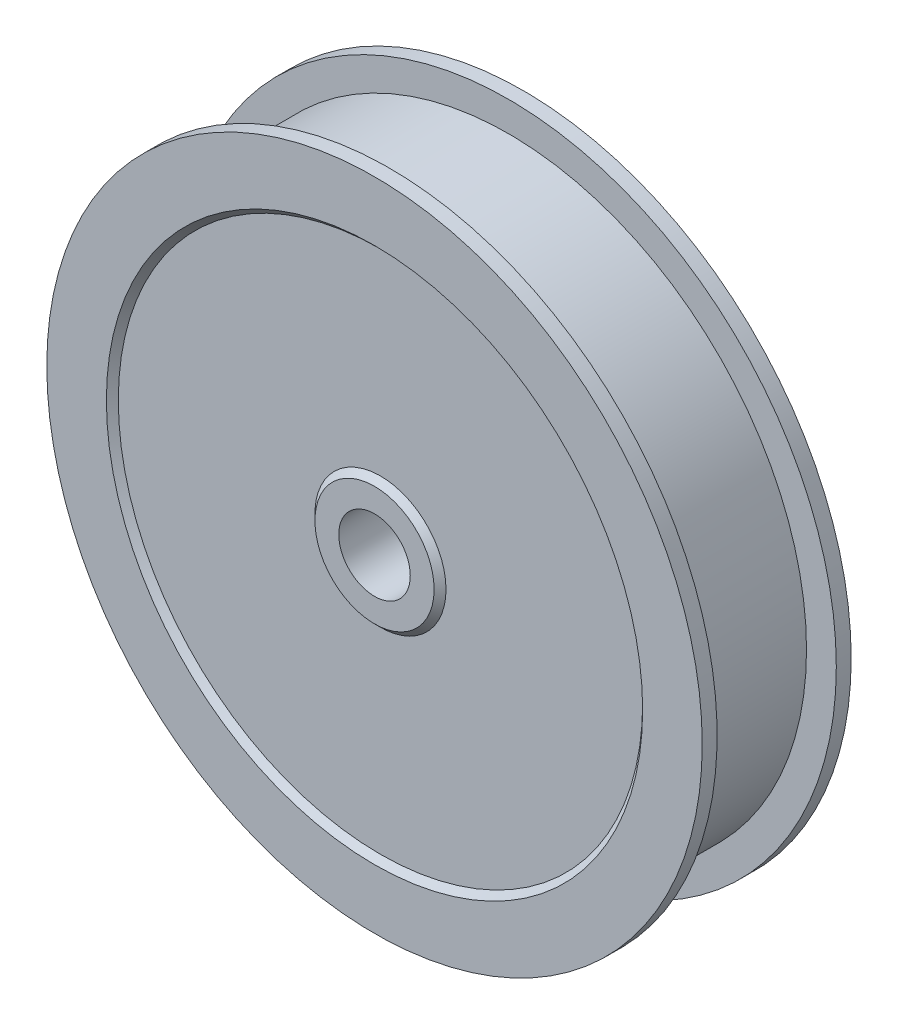
from build123d import *

# Parameters (mm, degrees)
CROQUIS1_R                 = 55
CROQUIS1_R_2               = 6
SALIENTE_EXTRUIR1_DEPTH    = 25
CROQUIS3_W                 = 20
CROQUIS3_H                 = 10
CROQUIS4_R                 = 45
CROQUIS4_R_2               = 10
CORTAR_EXTRUIR1_DEPTH      = 1
CHAFL_N1_SIZE              = 1
CHAFL_N1_OF_SIMETR_A2_SIZE = 1


with BuildPart() as part:
    # Croquis1 → Saliente-Extruir1 (new body)
    with BuildSketch(Plane.XY):
        Circle(CROQUIS1_R)
        Circle(CROQUIS1_R_2, mode=Mode.SUBTRACT)
    extrude(amount=SALIENTE_EXTRUIR1_DEPTH)

    # Croquis3 → Cortar-Revolución1 (revolve, cut)
    with BuildSketch(Plane(origin=(0, 0, 0), x_dir=(0, 0, -1), z_dir=(1, 0, 0)), mode=Mode.PRIVATE) as cortar_revoluci_n1_sk:
        with Locations((-12.5, 55)):
            Rectangle(CROQUIS3_W, CROQUIS3_H)
    revolve(cortar_revoluci_n1_sk.sketch.rotate(Axis((0, 0, 25), (0, 0, -1)), 90), axis=Axis((0, 0, 25), (0, 0, -1)), mode=Mode.SUBTRACT)

    # Croquis4 → Cortar-Extruir1 (cut)
    with BuildSketch(Plane.XY.offset(25)):
        Circle(CROQUIS4_R)
        Circle(CROQUIS4_R_2, mode=Mode.SUBTRACT)
    cortar_extruir1 = extrude(amount=-CORTAR_EXTRUIR1_DEPTH, mode=Mode.SUBTRACT)

    # Chaflán1
    chafl_n1_edges = [part.edges().sort_by_distance(p)[0] for p in [
        (-45, 0, 24),
        (-10, 0, 24),
    ]]
    chamfer(chafl_n1_edges, length=CHAFL_N1_SIZE - 0.0001)  # a hair under: the kernel refuses the full size

    # Simetría2: Cortar-Extruir1 across plane
    add(cortar_extruir1.mirror(Plane.XY.offset(12.5)), mode=Mode.SUBTRACT)

    # Chaflán1 of Simetría2
    chafl_n1_of_simetr_a2_edges = [part.edges().sort_by_distance(p)[0] for p in [
        (-45, 0, 1),
        (-10, 0, 1),
    ]]
    chamfer(chafl_n1_of_simetr_a2_edges, length=CHAFL_N1_OF_SIMETR_A2_SIZE - 0.0001)  # a hair under: the kernel refuses the full size


solid = part.part
